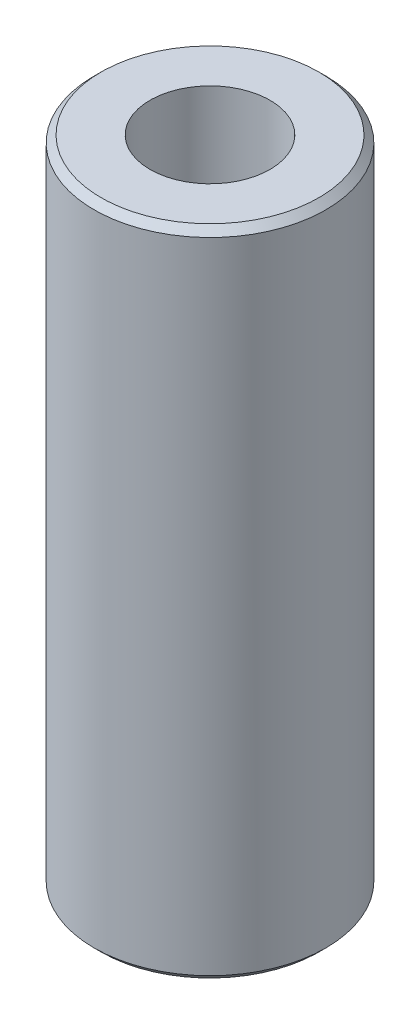
from build123d import *

# Parameters (mm, degrees)
SKETCH1_R           = 52.5
BOSS_EXTRUDE1_DEPTH = 295.942166494
SKETCH2_R           = 27.183721961
CUT_EXTRUDE1_DEPTH  = 306.113529541
CHAMFER1_SIZE       = 3.166779561


with BuildPart() as part:
    # Sketch1 → Boss-Extrude1 (new body)
    with BuildSketch(Plane(origin=(0, 0, 0), x_dir=(1, 0, 0), z_dir=(0, 1, 0))):
        Circle(SKETCH1_R)
    extrude(amount=BOSS_EXTRUDE1_DEPTH)

    # Sketch2 → Cut-Extrude1 (cut, through all)
    with BuildSketch(Plane(origin=(0, 0, 0), x_dir=(1, 0, 0), z_dir=(0, 1, 0))):
        Circle(SKETCH2_R)
    extrude(amount=CUT_EXTRUDE1_DEPTH, mode=Mode.SUBTRACT)

    # Chamfer1
    chamfer1_edges = [part.edges().sort_by_distance(p)[0] for p in [
        (-52.5, 295.942166494, 0),
        (-52.5, 0, 0),
    ]]
    chamfer(chamfer1_edges, length=CHAMFER1_SIZE)


solid = part.part
